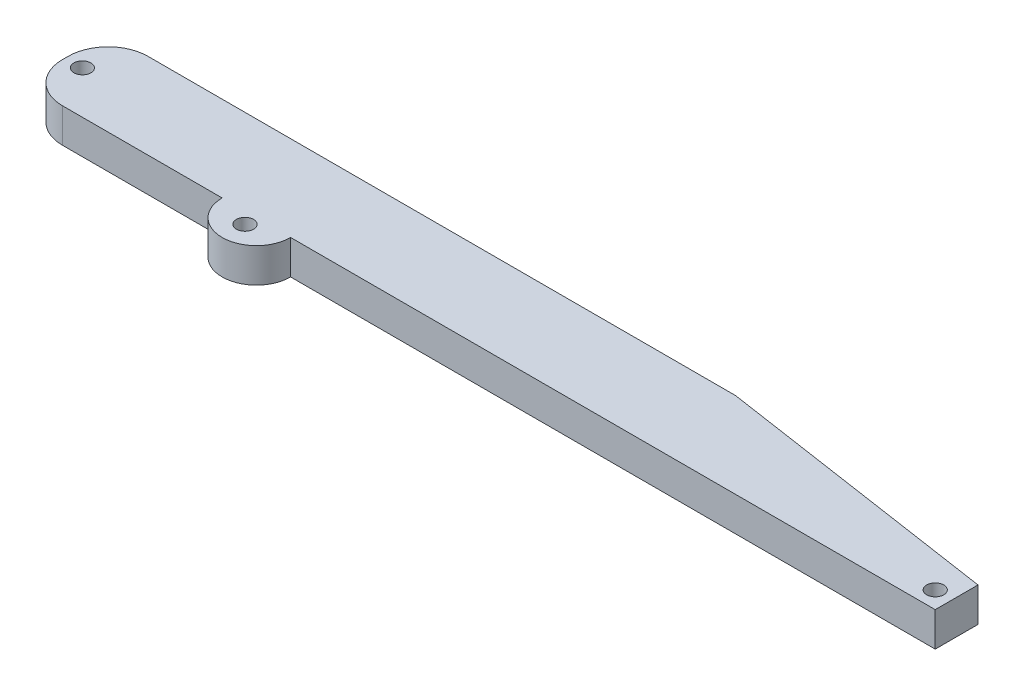
from build123d import *

# Parameters (mm, degrees)
SKETCH2_W           = 160
SKETCH2_H           = 15
BOSS_EXTRUDE1_DEPTH = 6
BOSS_EXTRUDE2_DEPTH = 6
SKETCH5_R           = 1.5
CUT_EXTRUDE1_DEPTH  = 82.352627493
CUT_EXTRUDE2_DEPTH  = 82.352627493
FILLET1_R           = 7


with BuildPart() as part:
    # Sketch2 → Boss-Extrude1 (new body)
    with BuildSketch(Plane(origin=(0, 0, 0), x_dir=(1, 0, 0), z_dir=(0, 1, 0))):
        Rectangle(SKETCH2_W, SKETCH2_H)
    extrude(amount=BOSS_EXTRUDE1_DEPTH)

    # Sketch4 → Boss-Extrude2 (add)
    with BuildSketch(Plane(origin=(0, 0, 0), x_dir=(1, 0, 0), z_dir=(0, 1, 0))):
        with BuildLine():
            Line((-45, -7.5), (-33, -7.5))
            ThreePointArc((-33, -7.5), (-39, -13.5), (-45, -7.5))
        make_face()
    extrude(amount=BOSS_EXTRUDE2_DEPTH)

    # Sketch5 → Cut-Extrude1 (cut, through all)
    with BuildSketch(Plane(origin=(0, 6, 0), x_dir=(1, 0, 0), z_dir=(0, 1, 0))):
        with Locations((-77, 0)):
            Circle(SKETCH5_R)
        with Locations((-39, -9.5)):
            Circle(SKETCH5_R)
        with Locations((77, -4.5)):
            Circle(SKETCH5_R)
    extrude(amount=-CUT_EXTRUDE1_DEPTH, mode=Mode.SUBTRACT)

    # Sketch6 → Cut-Extrude2 (cut, through all)
    with BuildSketch(Plane(origin=(0, 6, 0), x_dir=(1, 0, 0), z_dir=(0, 1, 0))):
        Polygon((80, 0), (80, 7.5), (30, 7.5), align=None)
    extrude(amount=-CUT_EXTRUDE2_DEPTH, mode=Mode.SUBTRACT)

    # Fillet1
    fillet1_edges = [part.edges().sort_by_distance(p)[0] for p in [
        (-80, 3, -7.5),
        (-80, 3, 7.5),
    ]]
    fillet(fillet1_edges, radius=FILLET1_R)


solid = part.part
